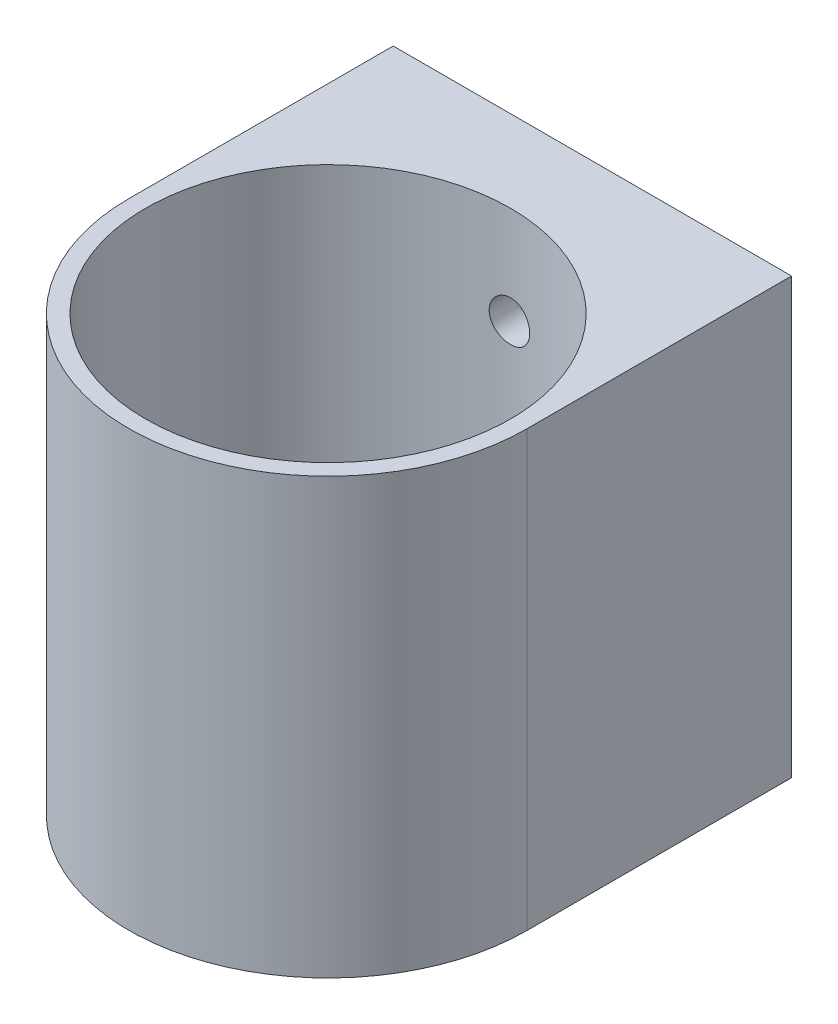
from build123d import *

# Parameters (mm, degrees)
SKETCH1_R             = 25.2
BOSS_EXTRUDE2_DEPTH   = 60
SKETCH3_R             = 25.2
BOSS_EXTRUDE3_DEPTH   = 9.3
SKETCH4_R             = 1.75
CUT_EXTRUDE1_DEPTH    = 81.850096247
SKETCH5_W             = 55
SKETCH5_H             = 60
SKETCH5_R             = 2.8
HEIGHT_INCREASE_DEPTH = 4
CUT_EXTRUDE2_START    = -30
SKETCH5_2_R           = 2.8
CUT_EXTRUDE2_DEPTH    = 30


with BuildPart() as part:
    # Sketch1 → Boss-Extrude2 (new body)
    with BuildSketch(Plane(origin=(0, 0, 0), x_dir=(1, 0, 0), z_dir=(0, 1, 0))):
        with BuildLine():
            Line((9.493421053, 16.463815789), (-45.506578947, 16.463815789))
            Line((-45.506578947, 16.463815789), (-45.506578947, -16.036184211))
            ThreePointArc((-45.506578947, -16.036184211), (-18.006578947, -43.536184211), (9.493421053, -16.036184211))
            Line((9.493421053, -16.036184211), (9.493421053, 16.463815789))
        make_face()
        with Locations((-18.006578947, -16.036184211)):
            Circle(SKETCH1_R, mode=Mode.SUBTRACT)
    extrude(amount=BOSS_EXTRUDE2_DEPTH)

    # Sketch3 → Boss-Extrude3 (add)
    with BuildSketch(Plane(origin=(0, 0, 0), x_dir=(-1, 0, 0), z_dir=(0, -1, 0))):
        with Locations((18.006578947, -16.036184211)):
            Circle(SKETCH3_R)
    extrude(amount=-BOSS_EXTRUDE3_DEPTH)

    # Sketch4 → Cut-Extrude1 (cut, through all)
    with BuildSketch(Plane(origin=(0, 9.3, 0), x_dir=(1, 0, 0), z_dir=(0, 1, 0))):
        with Locations((-18.006578947, -36.036184211)):
            Circle(SKETCH4_R)
        with Locations((-38.006578947, -16.036184211)):
            Circle(SKETCH4_R)
        with Locations((-33.04333339, -16.036184211)):
            Circle(SKETCH4_R)
        with Locations((-28.006578947, -16.036184211)):
            Circle(SKETCH4_R)
        with Locations((-23.006578947, -16.036184211)):
            Circle(SKETCH4_R)
        with Locations((-18.006578947, 3.963815789)):
            Circle(SKETCH4_R)
        with Locations((-18.006578947, -1.036184211)):
            Circle(SKETCH4_R)
        with Locations((-18.006578947, -6.036184211)):
            Circle(SKETCH4_R)
        with Locations((-18.006578947, -11.036184211)):
            Circle(SKETCH4_R)
        with Locations((1.993421053, -16.036184211)):
            Circle(SKETCH4_R)
        with Locations((-3.118703261, -16.036184211)):
            Circle(SKETCH4_R)
        with Locations((-8.006578947, -16.036184211)):
            Circle(SKETCH4_R)
        with Locations((-13.006578947, -16.036184211)):
            Circle(SKETCH4_R)
        with Locations((-18.006578947, -16.036184211)):
            Circle(SKETCH4_R)
        with Locations((-18.006578947, -21.036184211)):
            Circle(SKETCH4_R)
        with Locations((-18.006578947, -26.036184211)):
            Circle(SKETCH4_R)
        with Locations((-18.006578947, -31.036184211)):
            Circle(SKETCH4_R)
        with Locations((-28.006578947, -6.036184211)):
            Circle(SKETCH4_R)
        with Locations((-8.006578947, -6.036184211)):
            Circle(SKETCH4_R)
        with Locations((-8.006578947, -26.036184211)):
            Circle(SKETCH4_R)
        with Locations((-28.006578947, -26.036184211)):
            Circle(SKETCH4_R)
        with Locations((-23.006578947, -6.036184211)):
            Circle(SKETCH4_R)
        with Locations((-13.006578947, -6.036184211)):
            Circle(SKETCH4_R)
        with Locations((-13.006578947, -21.036184211)):
            Circle(SKETCH4_R)
        with Locations((-23.006578947, -21.036184211)):
            Circle(SKETCH4_R)
        with Locations((-28.006578947, -21.036184211)):
            Circle(SKETCH4_R)
        with Locations((-33.006578947, -21.036184211)):
            Circle(SKETCH4_R)
        with Locations((-23.006578947, -26.036184211)):
            Circle(SKETCH4_R)
        with Locations((-13.006578947, -26.036184211)):
            Circle(SKETCH4_R)
        with Locations((-13.006578947, -31.036184211)):
            Circle(SKETCH4_R)
        with Locations((-23.006578947, -31.036184211)):
            Circle(SKETCH4_R)
        with Locations((-8.006578947, -21.036184211)):
            Circle(SKETCH4_R)
        with Locations((-3.006578947, -21.036184211)):
            Circle(SKETCH4_R)
        with Locations((-23.006578947, -11.036184211)):
            Circle(SKETCH4_R)
        with Locations((-28.006578947, -11.036184211)):
            Circle(SKETCH4_R)
        with Locations((-33.006578947, -11.036184211)):
            Circle(SKETCH4_R)
        with Locations((-13.006578947, -11.036184211)):
            Circle(SKETCH4_R)
        with Locations((-8.006578947, -11.036184211)):
            Circle(SKETCH4_R)
        with Locations((-3.006578947, -11.036184211)):
            Circle(SKETCH4_R)
        with Locations((-23.006578947, -1.036184211)):
            Circle(SKETCH4_R)
        with Locations((-13.006578947, -1.036184211)):
            Circle(SKETCH4_R)
    extrude(amount=-CUT_EXTRUDE1_DEPTH, mode=Mode.SUBTRACT)

    # Sketch5 → height increase (add)
    with BuildSketch(Plane(origin=(0, 0, -16.463815789), x_dir=(-1, 0, 0), z_dir=(0, 0, -1))):
        with Locations((18.006578947, 30)):
            Rectangle(SKETCH5_W, SKETCH5_H)
        with Locations((18.006578947, 46.5)):
            Circle(SKETCH5_R, mode=Mode.SUBTRACT)
        with Locations((18.006578947, 13.5)):
            Circle(SKETCH5_R, mode=Mode.SUBTRACT)
    extrude(amount=HEIGHT_INCREASE_DEPTH)

    # Sketch5<2> → Cut-Extrude2 (cut)
    with BuildSketch(Plane(origin=(0, 0, -16.463815789), x_dir=(-1, 0, 0), z_dir=(0, 0, -1)).offset(CUT_EXTRUDE2_START)):
        with Locations((18.006578947, 46.5)):
            Circle(SKETCH5_2_R)
        with Locations((18.006578947, 13.5)):
            Circle(SKETCH5_2_R)
    extrude(amount=CUT_EXTRUDE2_DEPTH, mode=Mode.SUBTRACT)


solid = part.part
